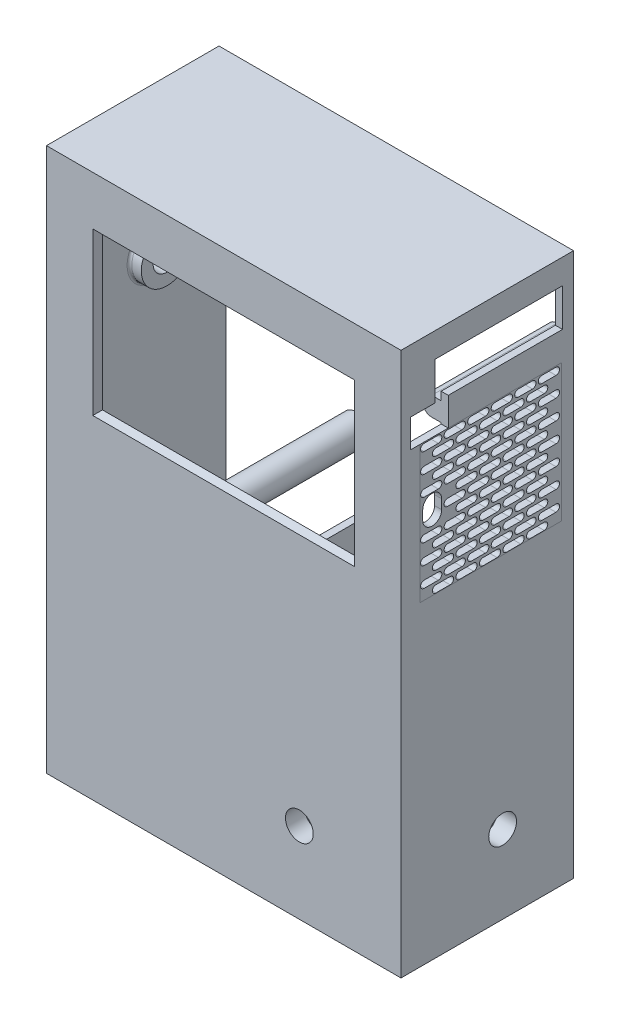
from build123d import *

# Parameters (mm, degrees)
SKETCH1_W                          = 150
SKETCH1_H                          = 230
OUTER_CASE_DEPTH                   = 73
CASE_THICKNESS_T                   = -3
SKETCH4_W                          = 108.6
SKETCH4_H                          = 66.2
DISPLAY_CUTOUT_DEPTH               = 155.110350074
DISPLAY_CUTOUT_TAPER               = -20
SKETCH5_W                          = 3
SKETCH5_H                          = 27.5
VALVE_SUPPORTER_DEPTH              = 30
SKETCH19_W                         = 2
SKETCH19_H                         = 27.5
VALVE_STOPPER_DEPTH                = 4.5
SKETCH7_R                          = 3.75
DISPLAY_MOUNT_DEPTH                = 6.2
DISPLAY_MOUNT_TAP_D                = 2.05
DISPLAY_MOUNT_TAP_DEPTH            = 5.7
DISPLAY_MOUNT_TAP_TIP              = 0.615882135
SKETCH13_R                         = 5.875
INLET_DEPTH                        = 201.40708587
INLET_START                        = 5
SKETCH14_R                         = 10.875
SKETCH14_R_2                       = 5.875
INLET_SUPPORT_DEPTH                = 5
SKETCH16_R                         = 3.5
RPI_MOUNT_DEPTH                    = 6
RPI_MOUNT_TAP_D                    = 2.05
RPI_MOUNT_TAP_DEPTH                = 5.5
RPI_MOUNT_TAP_TIP                  = 0.615882135
SKETCH18_W                         = 54
SKETCH18_H                         = 16
RPI_CUTOUT_DEPTH                   = 201.40708587
CUT_EXTRUDE1_REACH                 = 202.407
VENT_SEED_REACH                    = 204.618
VENT_START                         = 72
VENT_PATTERN_DEPTH                 = 3
SKETCH22_W                         = 15.5
SKETCH22_H                         = 21.9
LA_MOUNT_DEPTH                     = 24
LA_START                           = -3
SKETCH23_W                         = 24
SKETCH23_H                         = 21.9
LA_SLOT_DEPTH                      = 9.5
DISPLAY_SCREW_PASSTHROUGH_REACH    = 145.649
SKETCH24_R                         = 2.5
LA_PINHOLE_REACH                   = 145.649
SKETCH25_R                         = 2
LA_MOUNT_SUPPORT_REACH             = 156.11
LA_MOUNT_FILLET_R                  = 1
CORNER_START                       = -70
SKETCH26_W                         = 8
SKETCH26_H                         = 8
CORNER_SUPPORT_DEPTH               = 70
SKETCH40_R                         = 6
CETER_SUPPORT_DEPTH                = 70
SUPPORT_FILLET_R                   = 4
LA_SUPPORT_DEPTH                   = 10
TAP_DRILL_FOR_M2_5X0_45_TAP3_D     = 2.05
TAP_DRILL_FOR_M2_5X0_45_TAP3_DEPTH = 9.5
TAP_DRILL_FOR_M2_5X0_45_TAP3_TIP   = 0.615882135
SKETCH32_R                         = 5.875
OUTLET_DEPTH                       = 3
OUTLET_START                       = 5
SKETCH34_R                         = 10.875
SKETCH34_R_2                       = 5.875
OUTLET_SUPPORT_DEPTH               = 5
GENERAL_FILLET_R                   = 1
TAP_DRILL_FOR_M2_5X0_45_TAP5_D     = 2.05
TAP_DRILL_FOR_M2_5X0_45_TAP5_DEPTH = 30
TAP_DRILL_FOR_M2_5X0_45_TAP5_TIP   = 0.615882135
CUT_EXTRUDE2_REACH                 = 204.618
SKETCH45_W                         = 16
SKETCH45_H                         = 12
SKETCH46_R                         = 10.875
BOSS_EXTRUDE1_DEPTH                = 5
FILLET1_R                          = 1
CUT_EXTRUDE4_REACH                 = 153.905
SKETCH47_R                         = 5.875


with BuildPart() as part:
    # Sketch1 → Outer Case (new body)
    with BuildSketch(Plane.XY):
        Rectangle(SKETCH1_W, SKETCH1_H)
    extrude(amount=OUTER_CASE_DEPTH)

    # Case Thickness
    case_thickness_openings = [part.faces().sort_by_distance(p)[0] for p in [
        (0, 0, 0),
    ]]
    offset(amount=CASE_THICKNESS_T, openings=case_thickness_openings, kind=Kind.INTERSECTION)

    # Sketch4 → Display Cutout (cut, through all)
    with BuildSketch(Plane(origin=(0, 0, 70), x_dir=(-1, 0, 0), z_dir=(0, 0, -1))):
        with Locations((0, 60.1)):
            Rectangle(SKETCH4_W, SKETCH4_H)
    extrude(amount=-DISPLAY_CUTOUT_DEPTH, taper=DISPLAY_CUTOUT_TAPER, mode=Mode.SUBTRACT)

    # Sketch5 → Valve Supporter (add)
    with BuildSketch(Plane(origin=(0, 0, 70), x_dir=(-1, 0, 0), z_dir=(0, 0, -1))):
        with Locations((-48.5, -2.25)):
            Rectangle(SKETCH5_W, SKETCH5_H)
        with Locations((-23.5, -2.25)):
            Rectangle(SKETCH5_W, SKETCH5_H)
    extrude(amount=VALVE_SUPPORTER_DEPTH)

    # Sketch19 → Valve Stopper (add)
    with BuildSketch(Plane(origin=(0, 0, 70), x_dir=(-1, 0, 0), z_dir=(0, 0, -1))):
        with Locations((-66.5, -2.25)):
            Rectangle(SKETCH19_W, SKETCH19_H)
        with Locations((-41.5, -2.25)):
            Rectangle(SKETCH19_W, SKETCH19_H)
    extrude(amount=VALVE_STOPPER_DEPTH)

    # Sketch7 → Display Mount (add)
    with BuildSketch(Plane(origin=(0, 0, 70), x_dir=(-1, 0, 0), z_dir=(0, 0, -1))):
        with Locations(Location((-56.35, 99.9, 0), (0, 0, 180))):
            Circle(SKETCH7_R)
        with Locations(Location((56.35, 99.9, 0), (0, 0, 180))):
            Circle(SKETCH7_R)
        with Locations(Location((56.35, 16.1, 0), (0, 0, 180))):
            Circle(SKETCH7_R)
        with Locations(Location((-56.35, 16.1, 0), (0, 0, 180))):
            Circle(SKETCH7_R)
    extrude(amount=DISPLAY_MOUNT_DEPTH)

    # Display Mount Tap
    with Locations(Plane(origin=(56.35, 99.9, 63.8), x_dir=(-1, 0, 0), z_dir=(0, 0, -1))):
        with Locations((0, 0), (112.7, 0), (0, -83.8), (112.7, -83.8)):
            Hole(DISPLAY_MOUNT_TAP_D / 2, depth=DISPLAY_MOUNT_TAP_DEPTH)
            with Locations((0, 0, -(DISPLAY_MOUNT_TAP_DEPTH + DISPLAY_MOUNT_TAP_TIP / 2))):  # 118° drill point
                Cone(0, DISPLAY_MOUNT_TAP_D / 2, DISPLAY_MOUNT_TAP_TIP, mode=Mode.SUBTRACT)

    # Sketch13 → Inlet (cut, through all)
    with BuildSketch(Plane.ZY.offset(-72)):
        with Locations(Location((30, -82, 0), (0, 0, 270))):
            Circle(SKETCH13_R)
    extrude(amount=-INLET_DEPTH, mode=Mode.SUBTRACT)

    # Sketch14 → Inlet Support (add)
    with BuildSketch(Plane.ZY.offset(-72).offset(INLET_START)):
        with Locations((30, -82)):
            Circle(SKETCH14_R)
        with Locations((30, -82)):
            Circle(SKETCH14_R_2, mode=Mode.SUBTRACT)
    extrude(amount=-INLET_SUPPORT_DEPTH)

    # Sketch16 → RPi Mount (add)
    with BuildSketch(Plane.XZ.offset(-112)):
        with Locations(Location((47.5, 7, 0), (0, 0, 270))):
            Circle(SKETCH16_R)
        with Locations(Location((-10.5, 7, 0), (0, 0, 270))):
            Circle(SKETCH16_R)
        with Locations(Location((-10.5, 56, 0), (0, 0, 270))):
            Circle(SKETCH16_R)
        with Locations(Location((47.5, 56, 0), (0, 0, 270))):
            Circle(SKETCH16_R)
    extrude(amount=RPI_MOUNT_DEPTH)

    # RPi Mount Tap
    with Locations(Plane(origin=(47.5, 106, 7), x_dir=(0, 0, -1), z_dir=(0, -1, 0))):
        with Locations((0, 0), (-49, 0), (0, -58), (-49, -58)):
            Hole(RPI_MOUNT_TAP_D / 2, depth=RPI_MOUNT_TAP_DEPTH)
            with Locations((0, 0, -(RPI_MOUNT_TAP_DEPTH + RPI_MOUNT_TAP_TIP / 2))):  # 118° drill point
                Cone(0, RPI_MOUNT_TAP_D / 2, RPI_MOUNT_TAP_TIP, mode=Mode.SUBTRACT)

    # Sketch18 → RPi Cutout (cut, through all)
    with BuildSketch(Plane.ZY.offset(-72)):
        with Locations((31.675, 96.5)):
            Rectangle(SKETCH18_W, SKETCH18_H)
    extrude(amount=-RPI_CUTOUT_DEPTH, mode=Mode.SUBTRACT)

    # Sketch44 → Cut-Extrude1 (cut, up to next)
    with BuildSketch(Plane.ZY.offset(-72), mode=Mode.PRIVATE) as cut_extrude1_sk1:
        with BuildLine():
            Line((55.8, 48), (55.8, 52))
            ThreePointArc((55.8, 52), (59.8, 56), (63.8, 52))
            Line((63.8, 52), (63.8, 48))
            ThreePointArc((63.8, 48), (59.8, 44), (55.8, 48))
        make_face()
    cut_extrude1_tool1 = extrude(cut_extrude1_sk1.sketch, amount=-CUT_EXTRUDE1_REACH, mode=Mode.PRIVATE) & part.part
    add(cut_extrude1_tool1.solids().sort_by_distance((72, 50, 59.8))[0], mode=Mode.SUBTRACT)

    # Sketch21 → Vent Seed (cut, up to next)
    with BuildSketch(Plane(origin=(75, 0, 0), x_dir=(0, 0, -1), z_dir=(1, 0, 0)), mode=Mode.PRIVATE) as vent_seed_sk1:
        with BuildLine():
            Line((-63.21410267, 76.012960927), (-57.21410267, 76.012960927))
            ThreePointArc((-57.21410267, 76.012960927), (-55.71410267, 74.512960927), (-57.21410267, 73.012960927))
            Line((-57.21410267, 73.012960927), (-63.21410267, 73.012960927))
            ThreePointArc((-63.21410267, 73.012960927), (-64.71410267, 74.512960927), (-63.21410267, 76.012960927))
        make_face()
    vent_seed_tool1 = extrude(vent_seed_sk1.sketch, amount=-VENT_SEED_REACH, mode=Mode.PRIVATE) & part.part
    add(vent_seed_tool1.solids().sort_by_distance((75, 74.512961, 60.214103))[0], mode=Mode.SUBTRACT)

    # Vent Pattern: read off the stored shape, not the designer's step
    # Vent Pattern outline → Vent Pattern (cut)
    with BuildSketch(Plane.YZ.offset(VENT_START)):
        with BuildLine():
            ThreePointArc((73.012960927, 47.25552491), (74.512960927, 45.75552491), (76.012960927, 47.25552491))
            Line((76.012960927, 47.25552491), (76.012960927, 53.25552491))
            ThreePointArc((76.012960927, 53.25552491), (74.512960927, 54.75552491), (73.012960927, 53.25552491))
            Line((73.012960927, 53.25552491), (73.012960927, 47.25552491))
        make_face()
        with BuildLine():
            ThreePointArc((73.012960927, 7.421213867), (74.512960927, 5.921213867), (76.012960927, 7.421213867))
            Line((76.012960927, 7.421213867), (76.012960927, 13.421213867))
            ThreePointArc((76.012960927, 13.421213867), (74.512960927, 14.921213867), (73.012960927, 13.421213867))
            Line((73.012960927, 13.421213867), (73.012960927, 7.421213867))
        make_face()
        with BuildLine():
            ThreePointArc((73.012960927, 27.338369388), (74.512960927, 25.838369388), (76.012960927, 27.338369388))
            Line((76.012960927, 27.338369388), (76.012960927, 33.338369388))
            ThreePointArc((76.012960927, 33.338369388), (74.512960927, 34.838369388), (73.012960927, 33.338369388))
            Line((73.012960927, 33.338369388), (73.012960927, 27.338369388))
        make_face()
        with BuildLine():
            ThreePointArc((73.012960927, 37.296947149), (74.512960927, 35.796947149), (76.012960927, 37.296947149))
            Line((76.012960927, 37.296947149), (76.012960927, 43.296947149))
            ThreePointArc((76.012960927, 43.296947149), (74.512960927, 44.796947149), (73.012960927, 43.296947149))
            Line((73.012960927, 43.296947149), (73.012960927, 37.296947149))
        make_face()
        with BuildLine():
            ThreePointArc((73.012960927, 17.379791628), (74.512960927, 15.879791628), (76.012960927, 17.379791628))
            Line((76.012960927, 17.379791628), (76.012960927, 23.379791628))
            ThreePointArc((76.012960927, 23.379791628), (74.512960927, 24.879791628), (73.012960927, 23.379791628))
            Line((73.012960927, 23.379791628), (73.012960927, 17.379791628))
        make_face()
        with BuildLine():
            Line((25.875527372, 27.338369388), (25.875527372, 33.338369388))
            ThreePointArc((25.875527372, 33.338369388), (24.375527372, 34.838369388), (22.875527372, 33.338369388))
            Line((22.875527372, 33.338369388), (22.875527372, 27.338369388))
            ThreePointArc((22.875527372, 27.338369388), (24.375527372, 25.838369388), (25.875527372, 27.338369388))
        make_face()
        with BuildLine():
            ThreePointArc((22.875527372, 7.421213867), (24.375527372, 5.921213867), (25.875527372, 7.421213867))
            Line((25.875527372, 7.421213867), (25.875527372, 13.421213867))
            ThreePointArc((25.875527372, 13.421213867), (24.375527372, 14.921213867), (22.875527372, 13.421213867))
            Line((22.875527372, 13.421213867), (22.875527372, 7.421213867))
        make_face()
        with BuildLine():
            ThreePointArc((22.875527372, 17.379791628), (24.375527372, 15.879791628), (25.875527372, 17.379791628))
            Line((25.875527372, 17.379791628), (25.875527372, 23.379791628))
            ThreePointArc((25.875527372, 23.379791628), (24.375527372, 24.879791628), (22.875527372, 23.379791628))
            Line((22.875527372, 23.379791628), (22.875527372, 17.379791628))
        make_face()
        with BuildLine():
            ThreePointArc((22.875527372, 47.25552491), (24.375527372, 45.75552491), (25.875527372, 47.25552491))
            Line((25.875527372, 47.25552491), (25.875527372, 53.25552491))
            ThreePointArc((25.875527372, 53.25552491), (24.375527372, 54.75552491), (22.875527372, 53.25552491))
            Line((22.875527372, 53.25552491), (22.875527372, 47.25552491))
        make_face()
        with BuildLine():
            ThreePointArc((22.875527372, 37.296947149), (24.375527372, 35.796947149), (25.875527372, 37.296947149))
            Line((25.875527372, 37.296947149), (25.875527372, 43.296947149))
            ThreePointArc((25.875527372, 43.296947149), (24.375527372, 44.796947149), (22.875527372, 43.296947149))
            Line((22.875527372, 43.296947149), (22.875527372, 37.296947149))
        make_face()
        with BuildLine():
            ThreePointArc((22.875527372, 57.21410267), (24.375527372, 55.71410267), (25.875527372, 57.21410267))
            Line((25.875527372, 57.21410267), (25.875527372, 63.21410267))
            ThreePointArc((25.875527372, 63.21410267), (24.375527372, 64.71410267), (22.875527372, 63.21410267))
            Line((22.875527372, 63.21410267), (22.875527372, 57.21410267))
        make_face()
        with BuildLine():
            Line((21.697407909, 32.317658269), (21.697407909, 38.317658269))
            ThreePointArc((21.697407909, 38.317658269), (20.197407909, 39.817658269), (18.697407909, 38.317658269))
            Line((18.697407909, 38.317658269), (18.697407909, 32.317658269))
            ThreePointArc((18.697407909, 32.317658269), (20.197407909, 30.817658269), (21.697407909, 32.317658269))
        make_face()
        with BuildLine():
            ThreePointArc((18.697407909, 12.400502748), (20.197407909, 10.900502748), (21.697407909, 12.400502748))
            Line((21.697407909, 12.400502748), (21.697407909, 18.400502748))
            ThreePointArc((21.697407909, 18.400502748), (20.197407909, 19.900502748), (18.697407909, 18.400502748))
            Line((18.697407909, 18.400502748), (18.697407909, 12.400502748))
        make_face()
        with BuildLine():
            ThreePointArc((18.697407909, 22.359080508), (20.197407909, 20.859080508), (21.697407909, 22.359080508))
            Line((21.697407909, 22.359080508), (21.697407909, 28.359080508))
            ThreePointArc((21.697407909, 28.359080508), (20.197407909, 29.859080508), (18.697407909, 28.359080508))
            Line((18.697407909, 28.359080508), (18.697407909, 22.359080508))
        make_face()
        with BuildLine():
            ThreePointArc((18.697407909, 52.23481379), (20.197407909, 50.73481379), (21.697407909, 52.23481379))
            Line((21.697407909, 52.23481379), (21.697407909, 58.23481379))
            ThreePointArc((21.697407909, 58.23481379), (20.197407909, 59.73481379), (18.697407909, 58.23481379))
            Line((18.697407909, 58.23481379), (18.697407909, 52.23481379))
        make_face()
        with BuildLine():
            ThreePointArc((18.697407909, 42.276236029), (20.197407909, 40.776236029), (21.697407909, 42.276236029))
            Line((21.697407909, 42.276236029), (21.697407909, 48.276236029))
            ThreePointArc((21.697407909, 48.276236029), (20.197407909, 49.776236029), (18.697407909, 48.276236029))
            Line((18.697407909, 48.276236029), (18.697407909, 42.276236029))
        make_face()
        with BuildLine():
            Line((34.231766298, 7.421213867), (34.231766298, 13.421213867))
            ThreePointArc((34.231766298, 13.421213867), (32.731766298, 14.921213867), (31.231766298, 13.421213867))
            Line((31.231766298, 13.421213867), (31.231766298, 7.421213867))
            ThreePointArc((31.231766298, 7.421213867), (32.731766298, 5.921213867), (34.231766298, 7.421213867))
        make_face()
        with BuildLine():
            ThreePointArc((31.231766298, 57.21410267), (32.731766298, 55.71410267), (34.231766298, 57.21410267))
            Line((34.231766298, 57.21410267), (34.231766298, 63.21410267))
            ThreePointArc((34.231766298, 63.21410267), (32.731766298, 64.71410267), (31.231766298, 63.21410267))
            Line((31.231766298, 63.21410267), (31.231766298, 57.21410267))
        make_face()
        with BuildLine():
            ThreePointArc((31.231766298, 37.296947149), (32.731766298, 35.796947149), (34.231766298, 37.296947149))
            Line((34.231766298, 37.296947149), (34.231766298, 43.296947149))
            ThreePointArc((34.231766298, 43.296947149), (32.731766298, 44.796947149), (31.231766298, 43.296947149))
            Line((31.231766298, 43.296947149), (31.231766298, 37.296947149))
        make_face()
        with BuildLine():
            ThreePointArc((31.231766298, 17.379791628), (32.731766298, 15.879791628), (34.231766298, 17.379791628))
            Line((34.231766298, 17.379791628), (34.231766298, 23.379791628))
            ThreePointArc((34.231766298, 23.379791628), (32.731766298, 24.879791628), (31.231766298, 23.379791628))
            Line((31.231766298, 23.379791628), (31.231766298, 17.379791628))
        make_face()
        with BuildLine():
            ThreePointArc((31.231766298, 27.338369388), (32.731766298, 25.838369388), (34.231766298, 27.338369388))
            Line((34.231766298, 27.338369388), (34.231766298, 33.338369388))
            ThreePointArc((34.231766298, 33.338369388), (32.731766298, 34.838369388), (31.231766298, 33.338369388))
            Line((31.231766298, 33.338369388), (31.231766298, 27.338369388))
        make_face()
        with BuildLine():
            ThreePointArc((31.231766298, 47.25552491), (32.731766298, 45.75552491), (34.231766298, 47.25552491))
            Line((34.231766298, 47.25552491), (34.231766298, 53.25552491))
            ThreePointArc((34.231766298, 53.25552491), (32.731766298, 54.75552491), (31.231766298, 53.25552491))
            Line((31.231766298, 53.25552491), (31.231766298, 47.25552491))
        make_face()
        with BuildLine():
            Line((30.053646835, 12.400502748), (30.053646835, 18.400502748))
            ThreePointArc((30.053646835, 18.400502748), (28.553646835, 19.900502748), (27.053646835, 18.400502748))
            Line((27.053646835, 18.400502748), (27.053646835, 12.400502748))
            ThreePointArc((27.053646835, 12.400502748), (28.553646835, 10.900502748), (30.053646835, 12.400502748))
        make_face()
        with BuildLine():
            ThreePointArc((27.053646835, 42.276236029), (28.553646835, 40.776236029), (30.053646835, 42.276236029))
            Line((30.053646835, 42.276236029), (30.053646835, 48.276236029))
            ThreePointArc((30.053646835, 48.276236029), (28.553646835, 49.776236029), (27.053646835, 48.276236029))
            Line((27.053646835, 48.276236029), (27.053646835, 42.276236029))
        make_face()
        with BuildLine():
            ThreePointArc((27.053646835, 22.359080508), (28.553646835, 20.859080508), (30.053646835, 22.359080508))
            Line((30.053646835, 22.359080508), (30.053646835, 28.359080508))
            ThreePointArc((30.053646835, 28.359080508), (28.553646835, 29.859080508), (27.053646835, 28.359080508))
            Line((27.053646835, 28.359080508), (27.053646835, 22.359080508))
        make_face()
        with BuildLine():
            ThreePointArc((27.053646835, 32.317658269), (28.553646835, 30.817658269), (30.053646835, 32.317658269))
            Line((30.053646835, 32.317658269), (30.053646835, 38.317658269))
            ThreePointArc((30.053646835, 38.317658269), (28.553646835, 39.817658269), (27.053646835, 38.317658269))
            Line((27.053646835, 38.317658269), (27.053646835, 32.317658269))
        make_face()
        with BuildLine():
            ThreePointArc((27.053646835, 52.23481379), (28.553646835, 50.73481379), (30.053646835, 52.23481379))
            Line((30.053646835, 52.23481379), (30.053646835, 58.23481379))
            ThreePointArc((30.053646835, 58.23481379), (28.553646835, 59.73481379), (27.053646835, 58.23481379))
            Line((27.053646835, 58.23481379), (27.053646835, 52.23481379))
        make_face()
        with BuildLine():
            Line((59.300483076, 37.296947149), (59.300483076, 43.296947149))
            ThreePointArc((59.300483076, 43.296947149), (57.800483076, 44.796947149), (56.300483076, 43.296947149))
            Line((56.300483076, 43.296947149), (56.300483076, 37.296947149))
            ThreePointArc((56.300483076, 37.296947149), (57.800483076, 35.796947149), (59.300483076, 37.296947149))
        make_face()
        with BuildLine():
            ThreePointArc((56.300483076, 27.338369388), (57.800483076, 25.838369388), (59.300483076, 27.338369388))
            Line((59.300483076, 27.338369388), (59.300483076, 33.338369388))
            ThreePointArc((59.300483076, 33.338369388), (57.800483076, 34.838369388), (56.300483076, 33.338369388))
            Line((56.300483076, 33.338369388), (56.300483076, 27.338369388))
        make_face()
        with BuildLine():
            ThreePointArc((56.300483076, 57.21410267), (57.800483076, 55.71410267), (59.300483076, 57.21410267))
            Line((59.300483076, 57.21410267), (59.300483076, 63.21410267))
            ThreePointArc((59.300483076, 63.21410267), (57.800483076, 64.71410267), (56.300483076, 63.21410267))
            Line((56.300483076, 63.21410267), (56.300483076, 57.21410267))
        make_face()
        with BuildLine():
            ThreePointArc((56.300483076, 47.25552491), (57.800483076, 45.75552491), (59.300483076, 47.25552491))
            Line((59.300483076, 47.25552491), (59.300483076, 53.25552491))
            ThreePointArc((59.300483076, 53.25552491), (57.800483076, 54.75552491), (56.300483076, 53.25552491))
            Line((56.300483076, 53.25552491), (56.300483076, 47.25552491))
        make_face()
        with BuildLine():
            ThreePointArc((56.300483076, 17.379791628), (57.800483076, 15.879791628), (59.300483076, 17.379791628))
            Line((59.300483076, 17.379791628), (59.300483076, 23.379791628))
            ThreePointArc((59.300483076, 23.379791628), (57.800483076, 24.879791628), (56.300483076, 23.379791628))
            Line((56.300483076, 23.379791628), (56.300483076, 17.379791628))
        make_face()
        with BuildLine():
            ThreePointArc((56.300483076, 7.421213867), (57.800483076, 5.921213867), (59.300483076, 7.421213867))
            Line((59.300483076, 7.421213867), (59.300483076, 13.421213867))
            ThreePointArc((59.300483076, 13.421213867), (57.800483076, 14.921213867), (56.300483076, 13.421213867))
            Line((56.300483076, 13.421213867), (56.300483076, 7.421213867))
        make_face()
        with BuildLine():
            Line((55.122363613, 42.276236029), (55.122363613, 48.276236029))
            ThreePointArc((55.122363613, 48.276236029), (53.622363613, 49.776236029), (52.122363613, 48.276236029))
            Line((52.122363613, 48.276236029), (52.122363613, 42.276236029))
            ThreePointArc((52.122363613, 42.276236029), (53.622363613, 40.776236029), (55.122363613, 42.276236029))
        make_face()
        with BuildLine():
            ThreePointArc((52.122363613, 32.317658269), (53.622363613, 30.817658269), (55.122363613, 32.317658269))
            Line((55.122363613, 32.317658269), (55.122363613, 38.317658269))
            ThreePointArc((55.122363613, 38.317658269), (53.622363613, 39.817658269), (52.122363613, 38.317658269))
            Line((52.122363613, 38.317658269), (52.122363613, 32.317658269))
        make_face()
        with BuildLine():
            ThreePointArc((52.122363613, 22.359080508), (53.622363613, 20.859080508), (55.122363613, 22.359080508))
            Line((55.122363613, 22.359080508), (55.122363613, 28.359080508))
            ThreePointArc((55.122363613, 28.359080508), (53.622363613, 29.859080508), (52.122363613, 28.359080508))
            Line((52.122363613, 28.359080508), (52.122363613, 22.359080508))
        make_face()
        with BuildLine():
            ThreePointArc((52.122363613, 12.400502748), (53.622363613, 10.900502748), (55.122363613, 12.400502748))
            Line((55.122363613, 12.400502748), (55.122363613, 18.400502748))
            ThreePointArc((55.122363613, 18.400502748), (53.622363613, 19.900502748), (52.122363613, 18.400502748))
            Line((52.122363613, 18.400502748), (52.122363613, 12.400502748))
        make_face()
        with BuildLine():
            Line((50.94424415, 47.25552491), (50.94424415, 53.25552491))
            ThreePointArc((50.94424415, 53.25552491), (49.44424415, 54.75552491), (47.94424415, 53.25552491))
            Line((47.94424415, 53.25552491), (47.94424415, 47.25552491))
            ThreePointArc((47.94424415, 47.25552491), (49.44424415, 45.75552491), (50.94424415, 47.25552491))
        make_face()
        with BuildLine():
            ThreePointArc((47.94424415, 37.296947149), (49.44424415, 35.796947149), (50.94424415, 37.296947149))
            Line((50.94424415, 37.296947149), (50.94424415, 43.296947149))
            ThreePointArc((50.94424415, 43.296947149), (49.44424415, 44.796947149), (47.94424415, 43.296947149))
            Line((47.94424415, 43.296947149), (47.94424415, 37.296947149))
        make_face()
        with BuildLine():
            ThreePointArc((47.94424415, 7.421213867), (49.44424415, 5.921213867), (50.94424415, 7.421213867))
            Line((50.94424415, 7.421213867), (50.94424415, 13.421213867))
            ThreePointArc((50.94424415, 13.421213867), (49.44424415, 14.921213867), (47.94424415, 13.421213867))
            Line((47.94424415, 13.421213867), (47.94424415, 7.421213867))
        make_face()
        with BuildLine():
            ThreePointArc((47.94424415, 27.338369388), (49.44424415, 25.838369388), (50.94424415, 27.338369388))
            Line((50.94424415, 27.338369388), (50.94424415, 33.338369388))
            ThreePointArc((50.94424415, 33.338369388), (49.44424415, 34.838369388), (47.94424415, 33.338369388))
            Line((47.94424415, 33.338369388), (47.94424415, 27.338369388))
        make_face()
        with BuildLine():
            ThreePointArc((47.94424415, 17.379791628), (49.44424415, 15.879791628), (50.94424415, 17.379791628))
            Line((50.94424415, 17.379791628), (50.94424415, 23.379791628))
            ThreePointArc((50.94424415, 23.379791628), (49.44424415, 24.879791628), (47.94424415, 23.379791628))
            Line((47.94424415, 23.379791628), (47.94424415, 17.379791628))
        make_face()
        with BuildLine():
            Line((42.588005224, 57.21410267), (42.588005224, 63.21410267))
            ThreePointArc((42.588005224, 63.21410267), (41.088005224, 64.71410267), (39.588005224, 63.21410267))
            Line((39.588005224, 63.21410267), (39.588005224, 57.21410267))
            ThreePointArc((39.588005224, 57.21410267), (41.088005224, 55.71410267), (42.588005224, 57.21410267))
        make_face()
        with BuildLine():
            ThreePointArc((39.588005224, 47.25552491), (41.088005224, 45.75552491), (42.588005224, 47.25552491))
            Line((42.588005224, 47.25552491), (42.588005224, 53.25552491))
            ThreePointArc((42.588005224, 53.25552491), (41.088005224, 54.75552491), (39.588005224, 53.25552491))
            Line((39.588005224, 53.25552491), (39.588005224, 47.25552491))
        make_face()
        with BuildLine():
            ThreePointArc((39.588005224, 17.379791628), (41.088005224, 15.879791628), (42.588005224, 17.379791628))
            Line((42.588005224, 17.379791628), (42.588005224, 23.379791628))
            ThreePointArc((42.588005224, 23.379791628), (41.088005224, 24.879791628), (39.588005224, 23.379791628))
            Line((39.588005224, 23.379791628), (39.588005224, 17.379791628))
        make_face()
        with BuildLine():
            ThreePointArc((39.588005224, 7.421213867), (41.088005224, 5.921213867), (42.588005224, 7.421213867))
            Line((42.588005224, 7.421213867), (42.588005224, 13.421213867))
            ThreePointArc((42.588005224, 13.421213867), (41.088005224, 14.921213867), (39.588005224, 13.421213867))
            Line((39.588005224, 13.421213867), (39.588005224, 7.421213867))
        make_face()
        with BuildLine():
            ThreePointArc((39.588005224, 37.296947149), (41.088005224, 35.796947149), (42.588005224, 37.296947149))
            Line((42.588005224, 37.296947149), (42.588005224, 43.296947149))
            ThreePointArc((42.588005224, 43.296947149), (41.088005224, 44.796947149), (39.588005224, 43.296947149))
            Line((39.588005224, 43.296947149), (39.588005224, 37.296947149))
        make_face()
        with BuildLine():
            ThreePointArc((39.588005224, 27.338369388), (41.088005224, 25.838369388), (42.588005224, 27.338369388))
            Line((42.588005224, 27.338369388), (42.588005224, 33.338369388))
            ThreePointArc((42.588005224, 33.338369388), (41.088005224, 34.838369388), (39.588005224, 33.338369388))
            Line((39.588005224, 33.338369388), (39.588005224, 27.338369388))
        make_face()
        with BuildLine():
            Line((71.834841464, 12.400502748), (71.834841464, 18.400502748))
            ThreePointArc((71.834841464, 18.400502748), (70.334841464, 19.900502748), (68.834841464, 18.400502748))
            Line((68.834841464, 18.400502748), (68.834841464, 12.400502748))
            ThreePointArc((68.834841464, 12.400502748), (70.334841464, 10.900502748), (71.834841464, 12.400502748))
        make_face()
        with BuildLine():
            ThreePointArc((68.834841464, 42.276236029), (70.334841464, 40.776236029), (71.834841464, 42.276236029))
            Line((71.834841464, 42.276236029), (71.834841464, 48.276236029))
            ThreePointArc((71.834841464, 48.276236029), (70.334841464, 49.776236029), (68.834841464, 48.276236029))
            Line((68.834841464, 48.276236029), (68.834841464, 42.276236029))
        make_face()
        with BuildLine():
            ThreePointArc((68.834841464, 52.23481379), (70.334841464, 50.73481379), (71.834841464, 52.23481379))
            Line((71.834841464, 52.23481379), (71.834841464, 58.23481379))
            ThreePointArc((71.834841464, 58.23481379), (70.334841464, 59.73481379), (68.834841464, 58.23481379))
            Line((68.834841464, 58.23481379), (68.834841464, 52.23481379))
        make_face()
        with BuildLine():
            ThreePointArc((68.834841464, 22.359080508), (70.334841464, 20.859080508), (71.834841464, 22.359080508))
            Line((71.834841464, 22.359080508), (71.834841464, 28.359080508))
            ThreePointArc((71.834841464, 28.359080508), (70.334841464, 29.859080508), (68.834841464, 28.359080508))
            Line((68.834841464, 28.359080508), (68.834841464, 22.359080508))
        make_face()
        with BuildLine():
            ThreePointArc((68.834841464, 32.317658269), (70.334841464, 30.817658269), (71.834841464, 32.317658269))
            Line((71.834841464, 32.317658269), (71.834841464, 38.317658269))
            ThreePointArc((71.834841464, 38.317658269), (70.334841464, 39.817658269), (68.834841464, 38.317658269))
            Line((68.834841464, 38.317658269), (68.834841464, 32.317658269))
        make_face()
        with BuildLine():
            Line((67.656722001, 17.379791628), (67.656722001, 23.379791628))
            ThreePointArc((67.656722001, 23.379791628), (66.156722001, 24.879791628), (64.656722001, 23.379791628))
            Line((64.656722001, 23.379791628), (64.656722001, 17.379791628))
            ThreePointArc((64.656722001, 17.379791628), (66.156722001, 15.879791628), (67.656722001, 17.379791628))
        make_face()
        with BuildLine():
            ThreePointArc((64.656722001, 7.421213867), (66.156722001, 5.921213867), (67.656722001, 7.421213867))
            Line((67.656722001, 7.421213867), (67.656722001, 13.421213867))
            ThreePointArc((67.656722001, 13.421213867), (66.156722001, 14.921213867), (64.656722001, 13.421213867))
            Line((64.656722001, 13.421213867), (64.656722001, 7.421213867))
        make_face()
        with BuildLine():
            ThreePointArc((64.656722001, 47.25552491), (66.156722001, 45.75552491), (67.656722001, 47.25552491))
            Line((67.656722001, 47.25552491), (67.656722001, 53.25552491))
            ThreePointArc((67.656722001, 53.25552491), (66.156722001, 54.75552491), (64.656722001, 53.25552491))
            Line((64.656722001, 53.25552491), (64.656722001, 47.25552491))
        make_face()
        with BuildLine():
            ThreePointArc((64.656722001, 57.21410267), (66.156722001, 55.71410267), (67.656722001, 57.21410267))
            Line((67.656722001, 57.21410267), (67.656722001, 63.21410267))
            ThreePointArc((67.656722001, 63.21410267), (66.156722001, 64.71410267), (64.656722001, 63.21410267))
            Line((64.656722001, 63.21410267), (64.656722001, 57.21410267))
        make_face()
        with BuildLine():
            ThreePointArc((64.656722001, 27.338369388), (66.156722001, 25.838369388), (67.656722001, 27.338369388))
            Line((67.656722001, 27.338369388), (67.656722001, 33.338369388))
            ThreePointArc((67.656722001, 33.338369388), (66.156722001, 34.838369388), (64.656722001, 33.338369388))
            Line((64.656722001, 33.338369388), (64.656722001, 27.338369388))
        make_face()
        with BuildLine():
            ThreePointArc((64.656722001, 37.296947149), (66.156722001, 35.796947149), (67.656722001, 37.296947149))
            Line((67.656722001, 37.296947149), (67.656722001, 43.296947149))
            ThreePointArc((67.656722001, 43.296947149), (66.156722001, 44.796947149), (64.656722001, 43.296947149))
            Line((64.656722001, 43.296947149), (64.656722001, 37.296947149))
        make_face()
        with BuildLine():
            Line((63.478602539, 22.359080508), (63.478602539, 28.359080508))
            ThreePointArc((63.478602539, 28.359080508), (61.978602539, 29.859080508), (60.478602539, 28.359080508))
            Line((60.478602539, 28.359080508), (60.478602539, 22.359080508))
            ThreePointArc((60.478602539, 22.359080508), (61.978602539, 20.859080508), (63.478602539, 22.359080508))
        make_face()
        with BuildLine():
            ThreePointArc((60.478602539, 52.23481379), (61.978602539, 50.73481379), (63.478602539, 52.23481379))
            Line((63.478602539, 52.23481379), (63.478602539, 58.23481379))
            ThreePointArc((63.478602539, 58.23481379), (61.978602539, 59.73481379), (60.478602539, 58.23481379))
            Line((60.478602539, 58.23481379), (60.478602539, 52.23481379))
        make_face()
        with BuildLine():
            ThreePointArc((60.478602539, 32.317658269), (61.978602539, 30.817658269), (63.478602539, 32.317658269))
            Line((63.478602539, 32.317658269), (63.478602539, 38.317658269))
            ThreePointArc((63.478602539, 38.317658269), (61.978602539, 39.817658269), (60.478602539, 38.317658269))
            Line((60.478602539, 38.317658269), (60.478602539, 32.317658269))
        make_face()
        with BuildLine():
            ThreePointArc((60.478602539, 42.276236029), (61.978602539, 40.776236029), (63.478602539, 42.276236029))
            Line((63.478602539, 42.276236029), (63.478602539, 48.276236029))
            ThreePointArc((63.478602539, 48.276236029), (61.978602539, 49.776236029), (60.478602539, 48.276236029))
            Line((60.478602539, 48.276236029), (60.478602539, 42.276236029))
        make_face()
        with BuildLine():
            ThreePointArc((60.478602539, 12.400502748), (61.978602539, 10.900502748), (63.478602539, 12.400502748))
            Line((63.478602539, 12.400502748), (63.478602539, 18.400502748))
            ThreePointArc((63.478602539, 18.400502748), (61.978602539, 19.900502748), (60.478602539, 18.400502748))
            Line((60.478602539, 18.400502748), (60.478602539, 12.400502748))
        make_face()
        with BuildLine():
            Line((38.409885761, 52.23481379), (38.409885761, 58.23481379))
            ThreePointArc((38.409885761, 58.23481379), (36.909885761, 59.73481379), (35.409885761, 58.23481379))
            Line((35.409885761, 58.23481379), (35.409885761, 52.23481379))
            ThreePointArc((35.409885761, 52.23481379), (36.909885761, 50.73481379), (38.409885761, 52.23481379))
        make_face()
        with BuildLine():
            ThreePointArc((35.409885761, 22.359080508), (36.909885761, 20.859080508), (38.409885761, 22.359080508))
            Line((38.409885761, 22.359080508), (38.409885761, 28.359080508))
            ThreePointArc((38.409885761, 28.359080508), (36.909885761, 29.859080508), (35.409885761, 28.359080508))
            Line((35.409885761, 28.359080508), (35.409885761, 22.359080508))
        make_face()
        with BuildLine():
            ThreePointArc((35.409885761, 12.400502748), (36.909885761, 10.900502748), (38.409885761, 12.400502748))
            Line((38.409885761, 12.400502748), (38.409885761, 18.400502748))
            ThreePointArc((38.409885761, 18.400502748), (36.909885761, 19.900502748), (35.409885761, 18.400502748))
            Line((35.409885761, 18.400502748), (35.409885761, 12.400502748))
        make_face()
        with BuildLine():
            ThreePointArc((35.409885761, 42.276236029), (36.909885761, 40.776236029), (38.409885761, 42.276236029))
            Line((38.409885761, 42.276236029), (38.409885761, 48.276236029))
            ThreePointArc((38.409885761, 48.276236029), (36.909885761, 49.776236029), (35.409885761, 48.276236029))
            Line((35.409885761, 48.276236029), (35.409885761, 42.276236029))
        make_face()
        with BuildLine():
            ThreePointArc((35.409885761, 32.317658269), (36.909885761, 30.817658269), (38.409885761, 32.317658269))
            Line((38.409885761, 32.317658269), (38.409885761, 38.317658269))
            ThreePointArc((38.409885761, 38.317658269), (36.909885761, 39.817658269), (35.409885761, 38.317658269))
            Line((35.409885761, 38.317658269), (35.409885761, 32.317658269))
        make_face()
        with BuildLine():
            Line((46.766124687, 42.276236029), (46.766124687, 48.276236029))
            ThreePointArc((46.766124687, 48.276236029), (45.266124687, 49.776236029), (43.766124687, 48.276236029))
            Line((43.766124687, 48.276236029), (43.766124687, 42.276236029))
            ThreePointArc((43.766124687, 42.276236029), (45.266124687, 40.776236029), (46.766124687, 42.276236029))
        make_face()
        with BuildLine():
            ThreePointArc((43.766124687, 12.400502748), (45.266124687, 10.900502748), (46.766124687, 12.400502748))
            Line((46.766124687, 12.400502748), (46.766124687, 18.400502748))
            ThreePointArc((46.766124687, 18.400502748), (45.266124687, 19.900502748), (43.766124687, 18.400502748))
            Line((43.766124687, 18.400502748), (43.766124687, 12.400502748))
        make_face()
        with BuildLine():
            ThreePointArc((43.766124687, 32.317658269), (45.266124687, 30.817658269), (46.766124687, 32.317658269))
            Line((46.766124687, 32.317658269), (46.766124687, 38.317658269))
            ThreePointArc((46.766124687, 38.317658269), (45.266124687, 39.817658269), (43.766124687, 38.317658269))
            Line((43.766124687, 38.317658269), (43.766124687, 32.317658269))
        make_face()
        with BuildLine():
            ThreePointArc((43.766124687, 22.359080508), (45.266124687, 20.859080508), (46.766124687, 22.359080508))
            Line((46.766124687, 22.359080508), (46.766124687, 28.359080508))
            ThreePointArc((46.766124687, 28.359080508), (45.266124687, 29.859080508), (43.766124687, 28.359080508))
            Line((43.766124687, 28.359080508), (43.766124687, 22.359080508))
        make_face()
    extrude(amount=VENT_PATTERN_DEPTH, mode=Mode.SUBTRACT)

    # Sketch22 → LA Mount (add)
    with BuildSketch(Plane(origin=(-72, 0, 0), x_dir=(0, 0, -1), z_dir=(1, 0, 0))):
        with Locations((-50, 101.05)):
            Rectangle(SKETCH22_W, SKETCH22_H)
    extrude(amount=LA_MOUNT_DEPTH)

    # Sketch23 → LA Slot (cut)
    with BuildSketch(Plane(origin=(0, 0, 42.25), x_dir=(-1, 0, 0), z_dir=(0, 0, -1)).offset(LA_START)):
        with Locations((60, 101.05)):
            Rectangle(SKETCH23_W, SKETCH23_H)
    extrude(amount=-LA_SLOT_DEPTH, mode=Mode.SUBTRACT)

    # Display Screw Passthrough: up to this face of the body (flat: up to its plane)
    display_screw_passthrough_end = Plane(part.part.faces().sort_by_distance((-60, 101.05, 57.75))[0])
    # Sketch24 → Display Screw Passthrough (cut, up to the picked face)
    with BuildSketch(Plane(origin=(0, 0, 42.25), x_dir=(-1, 0, 0), z_dir=(0, 0, -1)), mode=Mode.PRIVATE) as display_screw_passthrough_sk1:
        with Locations(Location((56.35, 99.9, 0), (0, 0, 90))):
            Circle(SKETCH24_R)
    display_screw_passthrough_tool1 = split(extrude(display_screw_passthrough_sk1.sketch, amount=-DISPLAY_SCREW_PASSTHROUGH_REACH, mode=Mode.PRIVATE), bisect_by=display_screw_passthrough_end, keep=Keep.BOTH, mode=Mode.PRIVATE)
    add(display_screw_passthrough_tool1.solids().sort_by(Axis((-56.35, 99.9, 42.25), (0, 0, 1)))[0], mode=Mode.SUBTRACT)

    # LA Pinhole: up to this face of the body (flat: up to its plane)
    la_pinhole_end = Plane(part.part.faces().sort_by_distance((-60.141645323, 101.094627979, 57.75))[0])
    # Sketch25 → LA Pinhole (cut, up to the picked face)
    with BuildSketch(Plane(origin=(0, 0, 42.25), x_dir=(-1, 0, 0), z_dir=(0, 0, -1)), mode=Mode.PRIVATE) as la_pinhole_sk1:
        with Locations(Location((52, 94.5, 0), (0, 0, 90))):
            Circle(SKETCH25_R)
    la_pinhole_tool1 = split(extrude(la_pinhole_sk1.sketch, amount=-LA_PINHOLE_REACH, mode=Mode.PRIVATE), bisect_by=la_pinhole_end, keep=Keep.BOTH, mode=Mode.PRIVATE)
    add(la_pinhole_tool1.solids().sort_by(Axis((-52, 94.5, 42.25), (0, 0, 1)))[0], mode=Mode.SUBTRACT)

    # Sketch28 → LA Mount Support (add, up to next)
    with BuildSketch(Plane(origin=(0, 0, 70), x_dir=(-1, 0, 0), z_dir=(0, 0, -1)), mode=Mode.PRIVATE) as la_mount_support_sk1:
        Polygon((72, 112), (48, 112), (48, 105.9), (62.35, 105.9), (62.35, 90.1), (72, 90.1), align=None)
    la_mount_support_tool1 = extrude(la_mount_support_sk1.sketch, amount=LA_MOUNT_SUPPORT_REACH, mode=Mode.PRIVATE) - part.part
    add(la_mount_support_tool1.solids().sort_by_distance((-63.660362, 103.363804, 70))[0])

    # LA Mount Fillet
    la_mount_fillet_edges = [part.edges().sort_by_distance(p)[0] for p in [
        (-72, 90.1, 62.375),
        (-55.175, 90.1, 57.75),
        (-48, 112, 43.75),
        (-48, 90.1, 56.25),
        (-48, 112, 62.375),
        (-48, 90.1, 43.75),
        (-72, 90.1, 43.75),
        (-48, 98, 57.75),
        (-55.175, 105.9, 57.75),
        (-62.35, 98, 57.75),
        (-62.35, 90.1, 63.875),
        (-62.35, 105.9, 63.875),
        (-48, 105.9, 63.875),
    ]]
    fillet(la_mount_fillet_edges, radius=LA_MOUNT_FILLET_R)

    # Sketch26 → Corner Support (add)
    with BuildSketch(Plane(origin=(0, 0, 0), x_dir=(-1, 0, 0), z_dir=(0, 0, -1)).offset(CORNER_START)):
        with Locations((68, 108)):
            Rectangle(SKETCH26_W, SKETCH26_H)
        with Locations((68, -108)):
            Rectangle(SKETCH26_W, SKETCH26_H)
        with Locations((-68, -108)):
            Rectangle(SKETCH26_W, SKETCH26_H)
        with Locations((-68, 81)):
            Rectangle(SKETCH26_W, SKETCH26_H)
    extrude(amount=CORNER_SUPPORT_DEPTH)

    # Sketch40 → Ceter Support (add)
    with BuildSketch(Plane(origin=(0, 0, 70), x_dir=(-1, 0, 0), z_dir=(0, 0, -1))):
        with Locations(Location((17, 4, 0), (0, 0, 180))):
            Circle(SKETCH40_R)
    extrude(amount=CETER_SUPPORT_DEPTH)

    # Support Fillet
    support_fillet_edges = [part.edges().sort_by_distance(p)[0] for p in [
        (-64, 104, 21.125),
        (-64, 104, 50),
        (-64, -104, 35),
        (64, -104, 35),
        (64, 77, 35),
        (64, 85, 35),
        (-23, 4, 70),
    ]]
    fillet(support_fillet_edges, radius=SUPPORT_FILLET_R - 0.0001)  # a hair under: the kernel refuses the full size

    # Sketch29 → LA Support (add)
    with BuildSketch(Plane(origin=(0, 0, 70), x_dir=(-1, 0, 0), z_dir=(0, 0, -1))):
        with BuildLine():
            Line((40.25, 10.5), (63.75, 10.5))
            ThreePointArc((63.75, 10.5), (69.75, 4.5), (63.75, -1.5))
            Line((63.75, -1.5), (40.25, -1.5))
            ThreePointArc((40.25, -1.5), (34.25, 4.5), (40.25, 10.5))
        make_face()
    extrude(amount=LA_SUPPORT_DEPTH)

    # Tap Drill for M2.5x0.45 Tap3
    with Locations(Plane(origin=(-40.25, 4.5, 60), x_dir=(-1, 0, 0), z_dir=(0, 0, -1))):
        with Locations((0, 0), (23.5, 0)):
            Hole(TAP_DRILL_FOR_M2_5X0_45_TAP3_D / 2, depth=TAP_DRILL_FOR_M2_5X0_45_TAP3_DEPTH)
            with Locations((0, 0, -(TAP_DRILL_FOR_M2_5X0_45_TAP3_DEPTH + TAP_DRILL_FOR_M2_5X0_45_TAP3_TIP / 2))):  # 118° drill point
                Cone(0, TAP_DRILL_FOR_M2_5X0_45_TAP3_D / 2, TAP_DRILL_FOR_M2_5X0_45_TAP3_TIP, mode=Mode.SUBTRACT)

    # Sketch32 → Outlet (cut)
    with BuildSketch(Plane(origin=(-72, 0, 0), x_dir=(0, 0, -1), z_dir=(1, 0, 0))):
        with Locations(Location((-30, 57, 0), (0, 0, 90))):
            Circle(SKETCH32_R)
    extrude(amount=-OUTLET_DEPTH, mode=Mode.SUBTRACT)

    # Sketch34 → Outlet Support (add)
    with BuildSketch(Plane(origin=(-72, 0, 0), x_dir=(0, 0, -1), z_dir=(1, 0, 0)).offset(OUTLET_START)):
        with Locations((-30, 57)):
            Circle(SKETCH34_R)
        with Locations((-30, 57)):
            Circle(SKETCH34_R_2, mode=Mode.SUBTRACT)
    extrude(amount=-OUTLET_SUPPORT_DEPTH)

    # General Fillet
    # the kernel refuses this fillet: 1 mm, written as the material it adds along each edge
    with BuildSketch(Plane(origin=(-56.35, 16.1, 70), x_dir=(1, 0, 0), z_dir=(0, 1, 0))) as general_fillet_piece_1:
        with BuildLine():
            CenterArc((3.75 + GENERAL_FILLET_R, GENERAL_FILLET_R), GENERAL_FILLET_R, 180, 90)
            Line((3.75, GENERAL_FILLET_R), (3.75, 0))
            Line((3.75, 0), (3.75 + GENERAL_FILLET_R, 0))
        make_face()
    revolve(axis=Axis((-56.35, 16.1, 70), (0, 0, -1)))
    with BuildSketch(Plane(origin=(72, -82, 30), x_dir=(0, 0, 1), z_dir=(0, -1, 0))) as general_fillet_piece_2:
        with BuildLine():
            CenterArc((10.875 + GENERAL_FILLET_R, GENERAL_FILLET_R), GENERAL_FILLET_R, 180, 90)
            Line((10.875, GENERAL_FILLET_R), (10.875, 0))
            Line((10.875, 0), (10.875 + GENERAL_FILLET_R, 0))
        make_face()
    revolve(axis=Axis((72, -82, 30), (-1, 0, 0)))
    with BuildSketch(Plane(origin=(47.5, 112, 7), x_dir=(0, 0, -1), z_dir=(-1, 0, 0))) as general_fillet_piece_3:
        with BuildLine():
            CenterArc((3.5 + GENERAL_FILLET_R, GENERAL_FILLET_R), GENERAL_FILLET_R, 180, 90)
            Line((3.5, GENERAL_FILLET_R), (3.5, 0))
            Line((3.5, 0), (3.5 + GENERAL_FILLET_R, 0))
        make_face()
    revolve(axis=Axis((47.5, 112, 7), (0, -1, 0)))
    with BuildSketch(Plane(origin=(-10.5, 112, 7), x_dir=(0, 0, -1), z_dir=(-1, 0, 0))) as general_fillet_piece_4:
        with BuildLine():
            CenterArc((3.5 + GENERAL_FILLET_R, GENERAL_FILLET_R), GENERAL_FILLET_R, 180, 90)
            Line((3.5, GENERAL_FILLET_R), (3.5, 0))
            Line((3.5, 0), (3.5 + GENERAL_FILLET_R, 0))
        make_face()
    revolve(axis=Axis((-10.5, 112, 7), (0, -1, 0)))
    with BuildSketch(Plane(origin=(-10.5, 112, 56), x_dir=(0, 0, -1), z_dir=(-1, 0, 0))) as general_fillet_piece_5:
        with BuildLine():
            CenterArc((3.5 + GENERAL_FILLET_R, GENERAL_FILLET_R), GENERAL_FILLET_R, 180, 90)
            Line((3.5, GENERAL_FILLET_R), (3.5, 0))
            Line((3.5, 0), (3.5 + GENERAL_FILLET_R, 0))
        make_face()
    revolve(axis=Axis((-10.5, 112, 56), (0, -1, 0)))
    with BuildSketch(Plane(origin=(47.5, 112, 56), x_dir=(0, 0, -1), z_dir=(-1, 0, 0))) as general_fillet_piece_6:
        with BuildLine():
            CenterArc((3.5 + GENERAL_FILLET_R, GENERAL_FILLET_R), GENERAL_FILLET_R, 180, 90)
            Line((3.5, GENERAL_FILLET_R), (3.5, 0))
            Line((3.5, 0), (3.5 + GENERAL_FILLET_R, 0))
        make_face()
    revolve(axis=Axis((47.5, 112, 56), (0, -1, 0)))
    with BuildSketch(Plane(origin=(-40.25, 4.5, 70), x_dir=(0, -1, 0), z_dir=(-1, 0, 0))) as general_fillet_piece_7:
        with BuildLine():
            CenterArc((6 + GENERAL_FILLET_R, -GENERAL_FILLET_R), GENERAL_FILLET_R, 90, 90)
            Line((6, -GENERAL_FILLET_R), (6, 0))
            Line((6, 0), (6 + GENERAL_FILLET_R, 0))
        make_face()
    revolve(axis=Axis((-40.25, 4.5, 70), (0, 0, 1)), revolution_arc=180)
    with BuildSketch(Plane(origin=(-63.75, -1.5, 70), x_dir=(0, -1, 0), z_dir=(1, 0, 0)), Plane(origin=(-40.25, 10.5, 70), x_dir=(0, 1, 0), z_dir=(-1, 0, 0))) as general_fillet_piece_8:
        with BuildLine():
            CenterArc((GENERAL_FILLET_R, GENERAL_FILLET_R), GENERAL_FILLET_R, 180, 90)
            Line((0, GENERAL_FILLET_R), (0, 0))
            Line((0, 0), (GENERAL_FILLET_R, 0))
        make_face()
    extrude(amount=23.5)
    with BuildSketch(Plane(origin=(-63.75, 4.5, 70), x_dir=(0, 1, 0), z_dir=(1, 0, 0))) as general_fillet_piece_9:
        with BuildLine():
            CenterArc((6 + GENERAL_FILLET_R, -GENERAL_FILLET_R), GENERAL_FILLET_R, 90, 90)
            Line((6, -GENERAL_FILLET_R), (6, 0))
            Line((6, 0), (6 + GENERAL_FILLET_R, 0))
        make_face()
    revolve(axis=Axis((-63.75, 4.5, 70), (0, 0, 1)), revolution_arc=180)
    with BuildSketch(Plane(origin=(-72, 57, 30), x_dir=(0, 0, -1), z_dir=(0, -1, 0))) as general_fillet_piece_10:
        with BuildLine():
            CenterArc((10.875 + GENERAL_FILLET_R, GENERAL_FILLET_R), GENERAL_FILLET_R, 180, 90)
            Line((10.875, GENERAL_FILLET_R), (10.875, 0))
            Line((10.875, 0), (10.875 + GENERAL_FILLET_R, 0))
        make_face()
    revolve(axis=Axis((-72, 57, 30), (1, 0, 0)))
    with BuildSketch(Plane(origin=(47, 11.5, 70), x_dir=(-1, 0, 0), z_dir=(0, -1, 0)), Plane(origin=(22, 11.5, 70), x_dir=(-1, 0, 0), z_dir=(0, -1, 0)), Plane(origin=(67.5, -16, 70), x_dir=(1, 0, 0), z_dir=(0, 1, 0)), Plane(origin=(42.5, -16, 70), x_dir=(1, 0, 0), z_dir=(0, 1, 0))) as general_fillet_piece_11:
        with BuildLine():
            CenterArc((GENERAL_FILLET_R, GENERAL_FILLET_R), GENERAL_FILLET_R, 180, 90)
            Line((0, GENERAL_FILLET_R), (0, 0))
            Line((0, 0), (GENERAL_FILLET_R, 0))
        make_face()
    extrude(amount=27.5)
    with BuildSketch(Plane(origin=(56.35, 99.9, 70), x_dir=(1, 0, 0), z_dir=(0, 1, 0))) as general_fillet_piece_12:
        with BuildLine():
            CenterArc((3.75 + GENERAL_FILLET_R, GENERAL_FILLET_R), GENERAL_FILLET_R, 180, 90)
            Line((3.75, GENERAL_FILLET_R), (3.75, 0))
            Line((3.75, 0), (3.75 + GENERAL_FILLET_R, 0))
        make_face()
    revolve(axis=Axis((56.35, 99.9, 70), (0, 0, -1)))
    with BuildSketch(Plane(origin=(56.35, 16.1, 70), x_dir=(1, 0, 0), z_dir=(0, 1, 0))) as general_fillet_piece_13:
        with BuildLine():
            CenterArc((3.75 + GENERAL_FILLET_R, GENERAL_FILLET_R), GENERAL_FILLET_R, 180, 90)
            Line((3.75, GENERAL_FILLET_R), (3.75, 0))
            Line((3.75, 0), (3.75 + GENERAL_FILLET_R, 0))
        make_face()
    revolve(axis=Axis((56.35, 16.1, 70), (0, 0, -1)))

    # Tap Drill for M2.5x0.45 Tap5
    with Locations(Plane(origin=(-68, 108, 0), x_dir=(-1, 0, 0), z_dir=(0, 0, -1))):
        with Locations((0, 0), (-136, -27), (-136, -216), (0, -216), (-51, -104)):
            Hole(TAP_DRILL_FOR_M2_5X0_45_TAP5_D / 2, depth=TAP_DRILL_FOR_M2_5X0_45_TAP5_DEPTH)
            with Locations((0, 0, -(TAP_DRILL_FOR_M2_5X0_45_TAP5_DEPTH + TAP_DRILL_FOR_M2_5X0_45_TAP5_TIP / 2))):  # 118° drill point
                Cone(0, TAP_DRILL_FOR_M2_5X0_45_TAP5_D / 2, TAP_DRILL_FOR_M2_5X0_45_TAP5_TIP, mode=Mode.SUBTRACT)

    # Sketch45 → Cut-Extrude2 (cut, up to next)
    with BuildSketch(Plane(origin=(75, 0, 0), x_dir=(0, 0, -1), z_dir=(1, 0, 0)), mode=Mode.PRIVATE) as cut_extrude2_sk1:
        with Locations((-61, 82.5)):
            Rectangle(SKETCH45_W, SKETCH45_H)
    cut_extrude2_tool1 = extrude(cut_extrude2_sk1.sketch, amount=-CUT_EXTRUDE2_REACH, mode=Mode.PRIVATE) & part.part
    add(cut_extrude2_tool1.solids().sort_by_distance((75, 82.5, 61))[0], mode=Mode.SUBTRACT)

    # Sketch46 → Boss-Extrude1 (add)
    with BuildSketch(Plane(origin=(0, 0, 70), x_dir=(-1, 0, 0), z_dir=(0, 0, -1))):
        with Locations(Location((-32, -80.796705155, 0), (0, 0, 180))):
            Circle(SKETCH46_R)
    extrude(amount=BOSS_EXTRUDE1_DEPTH)

    # Fillet1
    fillet1_edges = [part.edges().sort_by_distance(p)[0] for p in [
        (21.125, -80.796705155, 70),
    ]]
    fillet(fillet1_edges, radius=FILLET1_R)

    # Sketch47 → Cut-Extrude4 (cut, up to next)
    with BuildSketch(Plane(origin=(0, 0, 65), x_dir=(-1, 0, 0), z_dir=(0, 0, -1)), mode=Mode.PRIVATE) as cut_extrude4_sk1:
        with Locations((-32, -80.796705155)):
            Circle(SKETCH47_R)
    cut_extrude4_tool1 = extrude(cut_extrude4_sk1.sketch, amount=-CUT_EXTRUDE4_REACH, mode=Mode.PRIVATE) & part.part
    add(cut_extrude4_tool1.solids().sort_by_distance((32, -80.796705, 65))[0], mode=Mode.SUBTRACT)


solid = part.part
